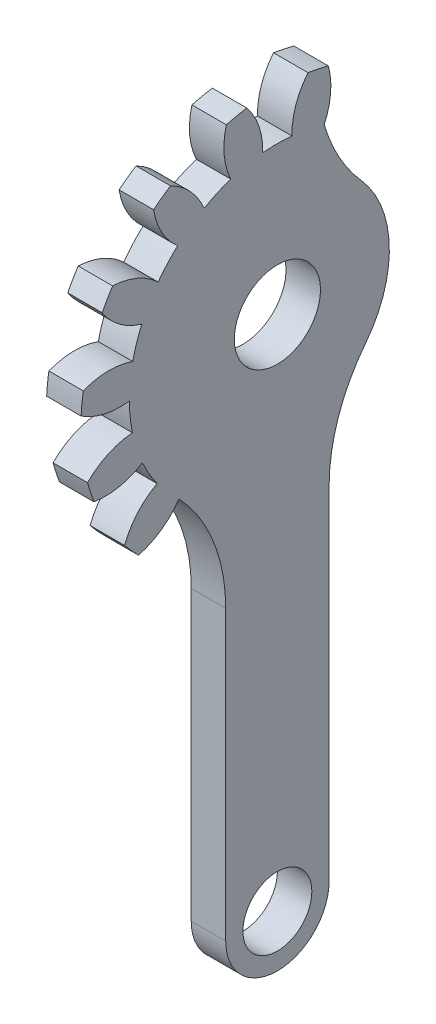
from build123d import *

# Parameters (mm, degrees)
SKETCH1_R           = 1.5
BOSS_EXTRUDE1_DEPTH = 2
SKETCH3_OUTSIDE_W   = 31.914
SKETCH3_OUTSIDE_H   = 31.796
SKETCH3_OUTSIDE_R   = 11.40725
CUT_EXTRUDE1_DEPTH  = 17.630863493
SKETCH4_R           = 2.5
CUT_EXTRUDE2_DEPTH  = 17.245136509
SKETCH5_R           = 2
BOSS_EXTRUDE2_DEPTH = 2
CUT_EXTRUDE3_DEPTH  = 35.968258573
CUT_EXTRUDE4_DEPTH  = 35.968258573
FILLET1_R           = 10


with BuildPart() as part:
    # Sketch1 → Boss-Extrude1 (new body)
    with BuildSketch(Plane(origin=(-1.354941904, 0, 0), x_dir=(0, 0, -1), z_dir=(1, 0, 0))):
        with BuildLine():
            ThreePointArc((-11.66138775, 0.780827758), (-10.210393031, 0.057188521), (-8.592596732, -0.051322118))
            ThreePointArc((-8.592596732, -0.051322118), (-8.545678016, -0.898186953), (-8.415498346, -1.736300708))
            ThreePointArc((-8.415498346, -1.736300708), (-9.975381284, -2.178798893), (-11.24421523, -3.188303642))
            ThreePointArc((-11.24421523, -3.188303642), (-11.115473034, -3.611636122), (-10.97079907, -4.029792056))
            ThreePointArc((-10.97079907, -4.029792056), (-9.350918841, -4.100696673), (-7.828853128, -3.541809038))
            ThreePointArc((-7.828853128, -3.541809038), (-7.441539788, -4.296375), (-6.981723166, -5.009081172))
            ThreePointArc((-6.981723166, -5.009081172), (-8.226766912, -6.047784929), (-8.975301827, -7.486094667))
            ThreePointArc((-8.975301827, -7.486094667), (-8.685505148, -7.820463962), (-8.383259564, -8.143624213))
            ThreePointArc((-8.383259564, -8.143624213), (-6.874585833, -7.549534157), (-5.711429695, -6.419884999))
            ThreePointArc((-5.711429695, -6.419884999), (-5.050691727, -6.951680778), (-4.340744624, -7.415745996))
            ThreePointArc((-4.340744624, -7.415745996), (-5.055669804, -8.871054007), (-5.154477201, -10.489471914))
            ThreePointArc((-5.154477201, -10.489471914), (-4.753734516, -10.677062536), (-4.34617832, -10.849349762))
            ThreePointArc((-4.34617832, -10.849349762), (-3.209574481, -9.692988601), (-2.606448181, -8.187904521))
            ThreePointArc((-2.606448181, -8.187904521), (-1.786533181, -8.404977796), (-0.949211902, -8.540160966))
            ThreePointArc((-0.949211902, -8.540160966), (-1.010401457, -10.160437258), (-0.442396639, -11.679124174))
            ThreePointArc((-0.442396639, -11.679124174), (0, -11.6875), (0.442396639, -11.679124174))
            ThreePointArc((0.442396639, -11.679124174), (1.010401457, -10.160437258), (0.949211902, -8.540160966))
            ThreePointArc((0.949211902, -8.540160966), (1.786533181, -8.404977796), (2.606448181, -8.187904521))
            ThreePointArc((2.606448181, -8.187904521), (3.209574481, -9.692988601), (4.34617832, -10.849349762))
            ThreePointArc((4.34617832, -10.849349762), (4.753734516, -10.677062536), (5.154477201, -10.489471914))
            ThreePointArc((5.154477201, -10.489471914), (5.055669804, -8.871054007), (4.340744624, -7.415745996))
            ThreePointArc((4.340744624, -7.415745996), (5.050691727, -6.951680778), (5.711429695, -6.419884999))
            ThreePointArc((5.711429695, -6.419884999), (6.874585833, -7.549534157), (8.383259564, -8.143624213))
            ThreePointArc((8.383259564, -8.143624213), (8.685505148, -7.820463962), (8.975301827, -7.486094667))
            ThreePointArc((8.975301827, -7.486094667), (8.226766912, -6.047784929), (6.981723166, -5.009081172))
            ThreePointArc((6.981723166, -5.009081172), (7.441539788, -4.296375), (7.828853128, -3.541809038))
            ThreePointArc((7.828853128, -3.541809038), (9.350918841, -4.100696673), (10.97079907, -4.029792056))
            ThreePointArc((10.97079907, -4.029792056), (11.115473034, -3.611636122), (11.24421523, -3.188303642))
            ThreePointArc((11.24421523, -3.188303642), (9.975381284, -2.178798893), (8.415498346, -1.736300708))
            ThreePointArc((8.415498346, -1.736300708), (8.545678016, -0.898186953), (8.592596732, -0.051322118))
            ThreePointArc((8.592596732, -0.051322118), (10.210393031, 0.057188521), (11.66138775, 0.780827758))
            ThreePointArc((11.66138775, 0.780827758), (11.623474652, 1.221676414), (11.568901669, 1.660774047))
            ThreePointArc((11.568901669, 1.660774047), (9.999161608, 2.066921265), (8.394157409, 1.836701922))
            ThreePointArc((8.394157409, 1.836701922), (8.17219088, 2.655305778), (7.8706023, 3.448038862))
            ThreePointArc((7.8706023, 3.448038862), (9.304397507, 4.205185299), (10.335616548, 5.456435359))
            ThreePointArc((10.335616548, 5.456435359), (10.121671907, 5.84375), (9.893219909, 6.222688815))
            ThreePointArc((9.893219909, 6.222688815), (8.29399605, 5.955251959), (6.921390398, 5.092122104))
            ThreePointArc((6.921390398, 5.092122104), (6.385657699, 5.749672018), (5.787709228, 6.351202599))
            ThreePointArc((5.787709228, 6.351202599), (6.789587127, 7.626067336), (7.222723349, 9.188575716))
            ThreePointArc((7.222723349, 9.188575716), (6.869740136, 9.455386122), (6.506910549, 9.708644156))
            ThreePointArc((6.506910549, 9.708644156), (5.154723227, 8.813865487), (4.251852108, 7.467068114))
            ThreePointArc((4.251852108, 7.467068114), (3.49498629, 7.849867731), (2.704068651, 8.156185707))
            ThreePointArc((2.704068651, 8.156185707), (3.100795451, 9.728333051), (2.860955666, 11.331927856))
            ThreePointArc((2.860955666, 11.331927856), (2.429967886, 11.432100084), (1.995497243, 11.515886722))
            ThreePointArc((1.995497243, 11.515886722), (1.124151929, 10.148481601), (0.847129962, 8.55089021))
            ThreePointArc((0.847129962, 8.55089021), (0, 8.59275), (-0.847129962, 8.55089021))
            ThreePointArc((-0.847129962, 8.55089021), (-1.124151929, 10.148481601), (-1.995497243, 11.515886722))
            ThreePointArc((-1.995497243, 11.515886722), (-2.429967886, 11.432100084), (-2.860955666, 11.331927856))
            ThreePointArc((-2.860955666, 11.331927856), (-3.100795451, 9.728333051), (-2.704068651, 8.156185707))
            ThreePointArc((-2.704068651, 8.156185707), (-3.49498629, 7.849867731), (-4.251852108, 7.467068114))
            ThreePointArc((-4.251852108, 7.467068114), (-5.154723227, 8.813865487), (-6.506910549, 9.708644156))
            ThreePointArc((-6.506910549, 9.708644156), (-6.869740136, 9.455386122), (-7.222723349, 9.188575716))
            ThreePointArc((-7.222723349, 9.188575716), (-6.789587127, 7.626067336), (-5.787709228, 6.351202599))
            ThreePointArc((-5.787709228, 6.351202599), (-6.385657699, 5.749672018), (-6.921390398, 5.092122104))
            ThreePointArc((-6.921390398, 5.092122104), (-8.29399605, 5.955251959), (-9.893219909, 6.222688815))
            ThreePointArc((-9.893219909, 6.222688815), (-10.121671907, 5.84375), (-10.335616548, 5.456435359))
            ThreePointArc((-10.335616548, 5.456435359), (-9.304397507, 4.205185299), (-7.8706023, 3.448038862))
            ThreePointArc((-7.8706023, 3.448038862), (-8.17219088, 2.655305778), (-8.394157409, 1.836701922))
            ThreePointArc((-8.394157409, 1.836701922), (-9.999161608, 2.066921265), (-11.568901669, 1.660774047))
            ThreePointArc((-11.568901669, 1.660774047), (-11.623474652, 1.221676414), (-11.66138775, 0.780827758))
        make_face()
        with Locations(Location((0, 0, 0), (0, 0, 180))):
            Circle(SKETCH1_R, mode=Mode.SUBTRACT)
    extrude(amount=-BOSS_EXTRUDE1_DEPTH)

    # Sketch3 outside → Cut-Extrude1 (cut, through all)
    with BuildSketch(Plane(origin=(-1.354941904, 0, 0), x_dir=(0, 0, -1), z_dir=(1, 0, 0))):
        with Locations((0, -0.086)):
            Rectangle(SKETCH3_OUTSIDE_W, SKETCH3_OUTSIDE_H)
        Circle(SKETCH3_OUTSIDE_R, mode=Mode.SUBTRACT)
    extrude(amount=-CUT_EXTRUDE1_DEPTH, mode=Mode.SUBTRACT)

    # Sketch4 → Cut-Extrude2 (cut, through all)
    with BuildSketch(Plane.ZY.offset(3.354941904)):
        Circle(SKETCH4_R)
    extrude(amount=-CUT_EXTRUDE2_DEPTH, mode=Mode.SUBTRACT)

    # Sketch5 → Boss-Extrude2 (add)
    with BuildSketch(Plane(origin=(-1.354941904, 0, 0), x_dir=(0, 0, -1), z_dir=(1, 0, 0))):
        with BuildLine():
            Line((-3, -30), (-3, -2.958198886))
            Line((-3, -2.958198886), (3, -2.958198886))
            Line((3, -2.958198886), (3, -30))
            ThreePointArc((3, -30), (0, -33), (-3, -30))
        make_face()
        with Locations((0, -30)):
            Circle(SKETCH5_R, mode=Mode.SUBTRACT)
    extrude(amount=-BOSS_EXTRUDE2_DEPTH)

    # Sketch6 → Cut-Extrude3 (cut, through all)
    with BuildSketch(Plane(origin=(-1.354941904, 0, 0), x_dir=(0, 0, -1), z_dir=(1, 0, 0))):
        with BuildLine():
            Line((3, -11.005696369), (3, -5.766281297))
            ThreePointArc((3, -5.766281297), (6.480220208, 0.506701151), (2.067265096, 6.162500712))
            Line((2.067265096, 6.162500712), (3.627970733, 10.81495173))
            ThreePointArc((3.627970733, 10.81495173), (11.4025291, -0.328150407), (3, -11.005696369))
        make_face()
    extrude(amount=-CUT_EXTRUDE3_DEPTH, mode=Mode.SUBTRACT)

    # Sketch7 → Cut-Extrude4 (cut, through all)
    with BuildSketch(Plane(origin=(-1.354941904, 0, 0), x_dir=(0, 0, -1), z_dir=(1, 0, 0))):
        with BuildLine():
            Line((-3, -11.005696369), (-3, -8.052040273))
            ThreePointArc((-3, -8.052040273), (-3.929768687, -7.641483536), (-4.804556181, -7.124015193))
            Line((-4.804556181, -7.124015193), (-6.378257659, -9.457440552))
            ThreePointArc((-6.378257659, -9.457440552), (-4.752599625, -10.370060239), (-3, -11.005696369))
        make_face()
    extrude(amount=-CUT_EXTRUDE4_DEPTH, mode=Mode.SUBTRACT)

    # Fillet1
    # the kernel refuses this fillet: 10 mm, written as the material it adds along each edge
    with BuildSketch(Plane(origin=(-1.354941904, -8.052040273, 3), x_dir=(0, -1, 0), z_dir=(-1, 0, 0))) as fillet1_piece_1:
        with BuildLine():
            CenterArc((5.214503978, 10), FILLET1_R, 226.79066028, 43.20933972)
            Line((-1.632155274, 2.711429695), (-1.769088459, 2.565658289))
            ThreePointArc((-1.769088459, 2.565658289), (-0.861521793, 1.328359568), (-0.187414746, -0.069826307))
            Line((-0.187414746, -0.069826307), (0, -0.2))
            Line((0, -0.2), (5.214503978, -0.2))
            Line((5.214503978, -0.2), (5.214503978, 0))
        make_face()
    extrude(amount=2)
    with BuildSketch(Plane(origin=(-1.354941904, 6.162500712, -2.067265096), x_dir=(0, 0.9480770325968022, -0.3180407839608656), z_dir=(-1, 0, 0))) as fillet1_piece_2:
        with BuildLine():
            CenterArc((7.819359493, 8.197923134), FILLET1_R, 209.791407991, 25.272600943)
            Line((-0.8590402, 3.229484871), (-1.032608194, 3.130116106))
            ThreePointArc((-1.032608194, 3.130116106), (-0.411709255, 1.619480105), (-0.2, 0))
            Line((-0.2, 0), (0, -0.2))
            ThreePointArc((0, -0.2), (1.046375, -0.2), (1.97821781, -0.163958463))
            Line((1.97821781, -0.163958463), (2.09275, 0))
        make_face()
    extrude(amount=2)
    with BuildSketch(Plane(origin=(-1.354941904, -5.766281297, -3), x_dir=(0, 0.6392655253408549, -0.7689860779693485), z_dir=(-1, 0, 0))) as fillet1_piece_3:
        with BuildLine():
            CenterArc((4.880340308, 9.772287101), FILLET1_R, 219.737073353, 38.012279544)
            Line((-2.809520471, 3.379631847), (-2.963317687, 3.251778742))
            Line((-2.963317687, 3.251778742), (-0.153797216, -0.127853105))
            Line((-0.153797216, -0.127853105), (0.042437742, -0.195445742))
            ThreePointArc((0.042437742, -0.195445742), (1.379226609, -0.051986615), (2.716015476, -0.195445742))
            Line((2.716015476, -0.195445742), (2.758453218, 0))
        make_face()
    extrude(amount=2)


solid = part.part
